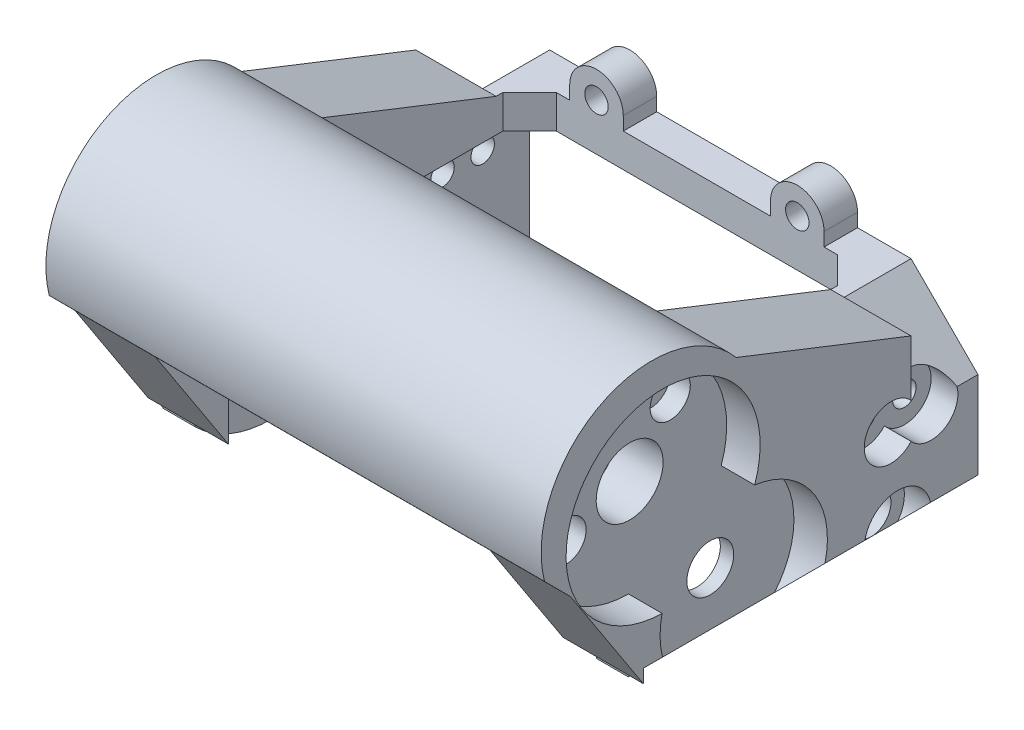
from build123d import *

# Parameters (mm, degrees)
BOSS_EXTRUDE1_DEPTH      = 50
CHAMFER1_SIZE            = 7
SKETCH2_R                = 3.5
CUT_EXTRUDE1_DEPTH       = 66.574385243
SKETCH3_R                = 1.75
CUT_EXTRUDE2_DEPTH       = 66.574385243
SKETCH5_R                = 12.5
CUT_EXTRUDE4_DEPTH       = 5
BOSS_EXTRUDE2_DEPTH      = 12
SKETCH4_W                = 50
SKETCH4_H                = 45
CUT_EXTRUDE3_DEPTH       = 78.43749616
SKETCH7_R                = 1.25
SKETCH7_R_2              = 5
CUT_EXTRUDE5_DEPTH       = 107.904819428
SKETCH8_R                = 14.5
CUT_EXTRUDE6_DEPTH       = 5
SKETCH9_R                = 3
CUT_EXTRUDE7_DEPTH       = 3
SKETCH11_R               = 2
CUT_EXTRUDE8_DEPTH       = 10
BOSS_EXTRUDE3_DEPTH      = 37
SKETCH12_R               = 3
CUT_EXTRUDE9_DEPTH       = 109.932742328
SKETCH13_R               = 5
CUT_EXTRUDE10_DEPTH      = 4
BOSS_EXTRUDE4_DEPTH      = 5
SKETCH16_R               = 1.75
CUT_EXTRUDE12_DEPTH      = 8
CHAMFER2_SIZE            = 4
CUT_EXTRUDE14_DEPTH      = 10
CUT_EXTRUDE15_DEPTH      = 89.087129357
CUT_EXTRUDE15_DEPTH_BACK = 89.087129357


# Read off the part's stored shape, not the designer's step: Mirror1
with BuildPart() as part:
    # Sketch1 → Boss-Extrude1 (new body)
    with BuildSketch(Plane.XY):
        Polygon((-30, 0), (-30, 25), (0, 25), (0, 30), (-37, 30), (-37, 0), align=None)
    extrude(amount=BOSS_EXTRUDE1_DEPTH)

    # Chamfer1
    chamfer1_edges = [part.edges().sort_by_distance(p)[0] for p in [
        (-37, 0, 25),
    ]]
    chamfer(chamfer1_edges, length=CHAMFER1_SIZE - 0.0001)  # a hair under: the kernel refuses the full size

    # Sketch2 → Cut-Extrude1 (cut, through all)
    with BuildSketch(Plane(origin=(-30, 0, 0), x_dir=(0, 0, -1), z_dir=(1, 0, 0))):
        with Locations((-35, 10)):
            Circle(SKETCH2_R)
    extrude(amount=-CUT_EXTRUDE1_DEPTH, mode=Mode.SUBTRACT)

    # Sketch3 → Cut-Extrude2 (cut, through all)
    with BuildSketch(Plane(origin=(-30, 0, 0), x_dir=(0, 0, -1), z_dir=(1, 0, 0))):
        with Locations((-7, 19)):
            Circle(SKETCH3_R)
        with Locations((-13, 19)):
            Circle(SKETCH3_R)
    extrude(amount=-CUT_EXTRUDE2_DEPTH, mode=Mode.SUBTRACT)

    # Sketch5 → Cut-Extrude4 (cut)
    with BuildSketch(Plane.ZY.offset(37)):
        with Locations((35, 10)):
            Circle(SKETCH5_R)
    extrude(amount=-CUT_EXTRUDE4_DEPTH, mode=Mode.SUBTRACT)

    # Sketch6 → Boss-Extrude2 (add)
    with BuildSketch(Plane.ZY.offset(37)):
        with BuildLine():
            Line((43.46072281, 43.154306904), (10, 30))
            Line((10, 30), (36.270468882, 30))
            ThreePointArc((36.270468882, 30), (40.249313761, 20.509847154), (50, 17.220724855))
            Line((50, 17.220724855), (50, 5))
            Line((50, 5), (60.912980238, 21.741514829))
            ThreePointArc((60.912980238, 21.741514829), (60.005508568, 38.820420112), (43.46072281, 43.154306904))
        make_face()
    extrude(amount=-BOSS_EXTRUDE2_DEPTH)

    # Mirror1: part across plane


with BuildPart() as part_1:
    add(part.part)
    add(part.part.mirror(Plane(origin=(0, 0, 0), x_dir=(0, 0, 1), z_dir=(1, 0, 0))))

    # Sketch4 → Cut-Extrude3 (cut, through all)
    with BuildSketch(Plane.XZ.offset(-25)):
        with Locations((0, 27.5)):
            Rectangle(SKETCH4_W, SKETCH4_H)
    extrude(amount=-CUT_EXTRUDE3_DEPTH, mode=Mode.SUBTRACT)

    # Sketch7 → Cut-Extrude5 (cut, through all)
    with BuildSketch(Plane.ZY.offset(37)):
        with Locations(Location((40.983890052, 35.108625208, 0), (0, 0, 270))):
            Circle(SKETCH7_R)
        with Locations(Location((56.547778893, 24.210672918, 0), (0, 0, 270))):
            Circle(SKETCH7_R)
        with Locations(Location((47.045105163, 27.20219293, 0), (0, 0, 270))):
            Circle(SKETCH7_R_2)
    extrude(amount=-CUT_EXTRUDE5_DEPTH, mode=Mode.SUBTRACT)

    # Sketch8 → Cut-Extrude6 (cut)
    with BuildSketch(Plane.ZY.offset(37)):
        with Locations((47.045105163, 27.20219293)):
            Circle(SKETCH8_R)
    cut_extrude6 = extrude(amount=-CUT_EXTRUDE6_DEPTH, mode=Mode.SUBTRACT)

    # Sketch9 → Cut-Extrude7 (cut)
    with BuildSketch(Plane.ZY.offset(32)):
        with Locations(Location((40.983890052, 35.108625208, 0), (0, 0, 270))):
            Circle(SKETCH9_R)
        with Locations(Location((56.547778893, 24.210672918, 0), (0, 0, 270))):
            Circle(SKETCH9_R)
    cut_extrude7 = extrude(amount=-CUT_EXTRUDE7_DEPTH, mode=Mode.SUBTRACT)

    # Sketch11 → Cut-Extrude8 (cut)
    with BuildSketch(Plane(origin=(0, 0, 0), x_dir=(-1, 0, 0), z_dir=(0, 0, -1))):
        with Locations((-33.5, 12)):
            Circle(SKETCH11_R)
    cut_extrude8 = extrude(amount=-CUT_EXTRUDE8_DEPTH, mode=Mode.SUBTRACT)

    # Mirror2: Cut-Extrude6, Cut-Extrude7, Cut-Extrude8 across plane
    add(cut_extrude6.mirror(Plane(origin=(0, 0, 0), x_dir=(0, 0, 1), z_dir=(1, 0, 0))), mode=Mode.SUBTRACT)
    add(cut_extrude7.mirror(Plane(origin=(0, 0, 0), x_dir=(0, 0, 1), z_dir=(1, 0, 0))), mode=Mode.SUBTRACT)
    add(cut_extrude8.mirror(Plane(origin=(0, 0, 0), x_dir=(0, 0, 1), z_dir=(1, 0, 0))), mode=Mode.SUBTRACT)

    # Sketch10 → Boss-Extrude3 (add, symmetric)
    with BuildSketch(Plane(origin=(0, 0, 0), x_dir=(0, 0, -1), z_dir=(1, 0, 0))):
        with BuildLine():
            Line((-43.46072281, 43.154306904), (-36.132650941, 40.273445456))
            ThreePointArc((-36.132650941, 40.273445456), (-56.287994506, 44.345257951), (-64.761056584, 25.609603432))
            Line((-64.761056584, 25.609603432), (-60.912980238, 21.741514829))
            ThreePointArc((-60.912980238, 21.741514829), (-60.005508568, 38.820420112), (-43.46072281, 43.154306904))
        make_face()
    extrude(amount=BOSS_EXTRUDE3_DEPTH, both=True)

    # Sketch12 → Cut-Extrude9 (cut, through all)
    with BuildSketch(Plane(origin=(37, 0, 0), x_dir=(0, 0, -1), z_dir=(1, 0, 0))):
        with Locations(Location((-12, 6, 0), (0, 0, 19.471220634))):
            Circle(SKETCH12_R)
    extrude(amount=-CUT_EXTRUDE9_DEPTH, mode=Mode.SUBTRACT)

    # Sketch13 → Cut-Extrude10 (cut)
    with BuildSketch(Plane(origin=(37, 0, 0), x_dir=(0, 0, -1), z_dir=(1, 0, 0))):
        with Locations((-12, 6)):
            Circle(SKETCH13_R)
        with BuildLine():
            ThreePointArc((-10, 21.645751311), (-17, 19), (-10, 16.354248689))
            ThreePointArc((-10, 16.354248689), (-3, 19), (-10, 21.645751311))
        make_face()
    cut_extrude10 = extrude(amount=-CUT_EXTRUDE10_DEPTH, mode=Mode.SUBTRACT)

    # Mirror3: Cut-Extrude10 across plane
    add(cut_extrude10.mirror(Plane(origin=(0, 0, 0), x_dir=(0, 0, 1), z_dir=(1, 0, 0))), mode=Mode.SUBTRACT)

    # Sketch15 → Boss-Extrude4 (add)
    with BuildSketch(Plane(origin=(0, 0, 0), x_dir=(-1, 0, 0), z_dir=(0, 0, -1))):
        with BuildLine():
            Line((-19, 32), (-19, 30))
            Line((-19, 30), (-11, 30))
            Line((-11, 30), (-11, 32))
            ThreePointArc((-11, 32), (-15, 36), (-19, 32))
        make_face()
        with BuildLine():
            Line((11, 30), (11, 32))
            ThreePointArc((11, 32), (15, 36), (19, 32))
            Line((19, 32), (19, 30))
            Line((19, 30), (11, 30))
        make_face()
    extrude(amount=-BOSS_EXTRUDE4_DEPTH)

    # Sketch16 → Cut-Extrude12 (cut)
    with BuildSketch(Plane(origin=(0, 0, 0), x_dir=(-1, 0, 0), z_dir=(0, 0, -1))):
        with Locations((-15, 32)):
            Circle(SKETCH16_R)
        with Locations((15, 32)):
            Circle(SKETCH16_R)
    extrude(amount=-CUT_EXTRUDE12_DEPTH, mode=Mode.SUBTRACT)

    # Chamfer2
    chamfer2_edges = [part_1.edges().sort_by_distance(p)[0] for p in [
        (25, 27.5, 5),
        (-25, 27.5, 5),
    ]]
    chamfer(chamfer2_edges, length=CHAMFER2_SIZE)

    # Sketch17 → Cut-Extrude14 (cut)
    with BuildSketch(Plane(origin=(0, 0, 0), x_dir=(-1, 0, 0), z_dir=(0, 0, -1))):
        Polygon((-37, 20), (-37, 30), (-27, 30), align=None)
        Polygon((37, 30), (27, 30), (37, 20), align=None)
    extrude(amount=-CUT_EXTRUDE14_DEPTH, mode=Mode.SUBTRACT)

    # Sketch18 → Cut-Extrude15 (cut, two sides: drawn at the far end of the back side and taken through both)
    with BuildSketch(Plane(origin=(0, 0, 0), x_dir=(0, 0, -1), z_dir=(1, 0, 0)).offset(-CUT_EXTRUDE15_DEPTH_BACK)):
        with BuildLine():
            Line((-38.575094924, 0), (-50, 0))
            Line((-50, 0), (-53.770765751, 10.784701278))
            ThreePointArc((-53.770765751, 10.784701278), (-47.891990779, 2.970190216), (-38.575094924, 0))
        make_face()
    extrude(amount=CUT_EXTRUDE15_DEPTH + CUT_EXTRUDE15_DEPTH_BACK, mode=Mode.SUBTRACT)


solid = part_1.part
